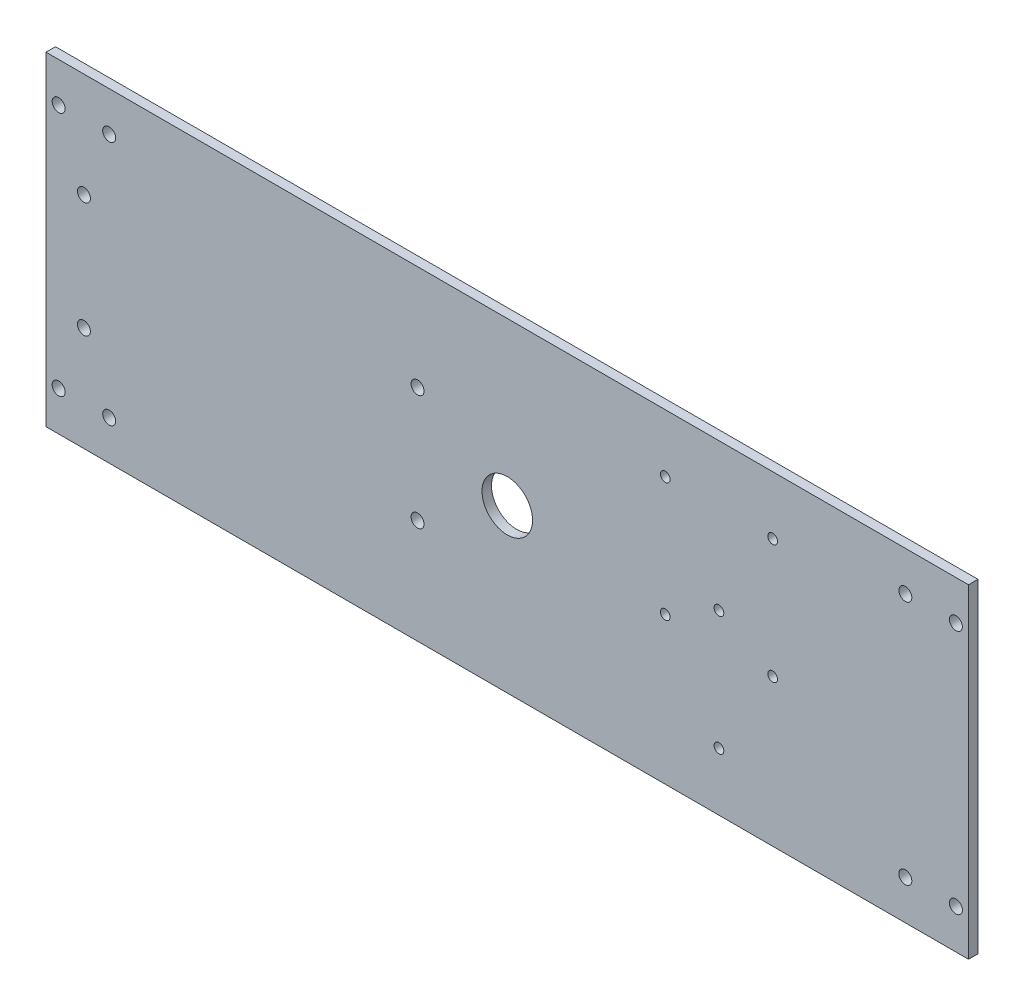
from build123d import *

# Parameters (mm, degrees)
SKETCH1_W                  = 231.775
SKETCH1_H                  = 81.4959
BOSS_EXTRUDE1_DEPTH        = 2.38125
F_4_CLEARANCE_HOLE2_D      = 3.2639
MIRROR3_COPY_1_D           = 3.2639
MIRROR3_COPY_2_D           = 3.2639
F_1_2_0_5_DIAMETER_HOLE1_D = 12.7
F_4_CLEARANCE_HOLE3_D      = 3.2639
F_2_CLEARANCE_HOLE1_D      = 2.4384
LPATTERN1_COUNT            = 2
LPATTERN1_PITCH            = 29.972


with BuildPart() as part:
    # Sketch1 → Boss-Extrude1 (new body)
    with BuildSketch(Plane.XY):
        Rectangle(SKETCH1_W, SKETCH1_H)
    extrude(amount=BOSS_EXTRUDE1_DEPTH)

    # #4 Clearance Hole2 (through all)
    with Locations(Plane.XY.offset(2.38125)):
        with Locations((-112.7125, 30.82036), (-100.0125, 30.82036)):
            f_4_clearance_hole2 = Hole(F_4_CLEARANCE_HOLE2_D / 2)

    # Mirror2: #4 Clearance Hole2 across plane
    add(f_4_clearance_hole2.mirror(Plane(origin=(0, 0, 0), x_dir=(0, 0, 1), z_dir=(1, 0, 0))), mode=Mode.SUBTRACT)

    # Mirror3 copy 1 (through all)
    with Locations(Plane(origin=(0, 0, 2.38125), x_dir=(-1, 0, 0), z_dir=(0, 0, 1))):
        with Locations((-112.7125, 30.82036), (-100.0125, 30.82036)):
            Hole(MIRROR3_COPY_1_D / 2)

    # Mirror3 copy 2 (through all)
    with Locations(Plane.XY.offset(2.38125)):
        with Locations((-112.7125, -30.82036), (-100.0125, -30.82036)):
            Hole(MIRROR3_COPY_2_D / 2)

    # 1/2 (0.5) Diameter Hole1 (through all)
    with Locations(Plane.XY.offset(2.38125)):
        with Locations((0, 0)):
            Hole(F_1_2_0_5_DIAMETER_HOLE1_D / 2)

    # #4 Clearance Hole3 (through all)
    with Locations(Plane.XY.offset(2.38125)):
        with Locations((-106.3625, 14.478), (-22.5425, 14.478), (-22.5425, -14.478), (-106.3625, -14.478)):
            Hole(F_4_CLEARANCE_HOLE3_D / 2)

    # #2 Clearance Hole1 (through all)
    with Locations(Plane.XY.offset(2.38125)):
        with Locations((53.184353902, 3.81), (39.696953902, 26.162), (66.671753902, 26.162)):
            f_2_clearance_hole1 = Hole(F_2_CLEARANCE_HOLE1_D / 2)

    # LPattern1: #2 Clearance Hole1 ×2
    with Locations(*[(0, -i * LPATTERN1_PITCH, 0) for i in range(1, LPATTERN1_COUNT)]):
        add(f_2_clearance_hole1, mode=Mode.SUBTRACT)


solid = part.part
